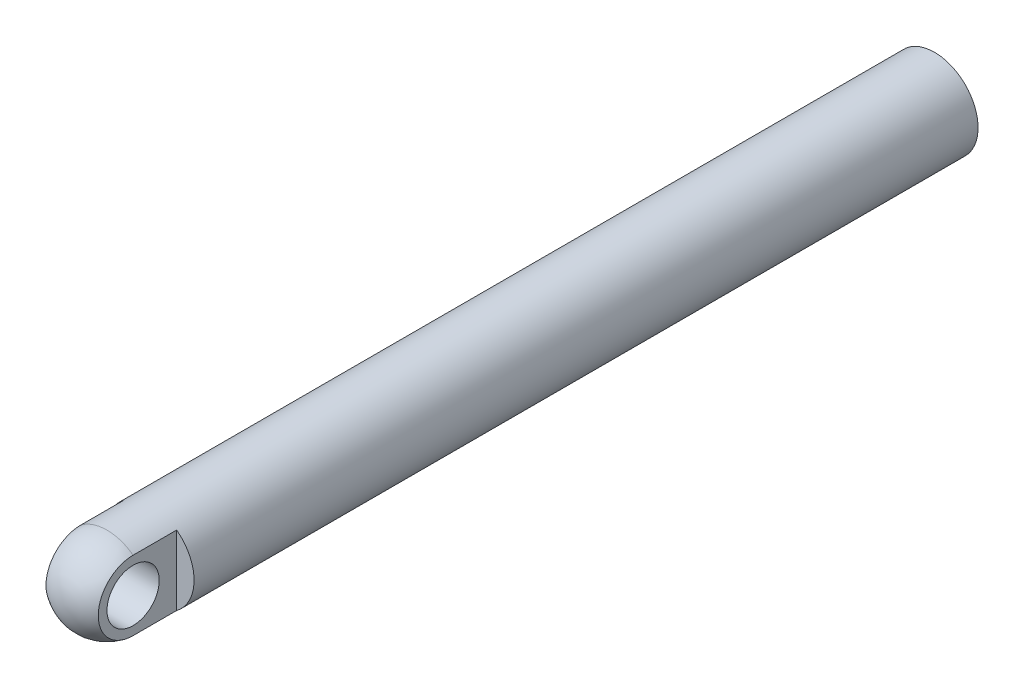
from build123d import *

# Parameters (mm, degrees)
SKETCH_1_R          = 50
EXTRUDE_1_DEPTH     = 1150
CUT_EXTRUDE_1_DEPTH = 100
SKETCH_3_R          = 30
CUT_EXTRUDE_2_DEPTH = 100
SKETCH_4_R          = 50
CUT_EXTRUDE_3_DEPTH = 100
SKETCH_6_R          = 72.906400888
CUT_EXTRUDE_4_DEPTH = 50
SCALE_1_SCALE       = 0.345


with BuildPart() as part:
    # 草图1 → 凸台-拉伸1 (new body)
    with BuildSketch(Plane.XY):
        Circle(SKETCH_1_R)
    extrude(amount=EXTRUDE_1_DEPTH)

    # 草图2 → 切除-拉伸1 (cut)
    with BuildSketch(Plane.XY.offset(1150)):
        Polygon((-30, 50), (-30, -50), (-82.719574124, -32.427051987), (-69.504020862, 45.153140313), align=None)
        Polygon((30, 50), (30, -50), (70.972415669, -45.887337717), (95.445662451, 11.135327286), align=None)
    extrude(amount=-CUT_EXTRUDE_1_DEPTH, mode=Mode.SUBTRACT)

    # 草图3 → 切除-拉伸2 (cut)
    with BuildSketch(Plane(origin=(30, 0, 0), x_dir=(0, 0, -1), z_dir=(1, 0, 0))):
        with Locations((-1100, 0)):
            Circle(SKETCH_3_R)
    extrude(amount=-CUT_EXTRUDE_2_DEPTH, mode=Mode.SUBTRACT)

    # 圆角1: read off the stored shape, not the designer's step
    # 圆角1 outline → 圆角1 (revolve, cut)
    with BuildSketch(Plane.XZ):
        with BuildLine():
            ThreePointArc((0, 1150), (35.355339077, 1135.355339042), (50, 1099.99999995))
            Line((50, 1099.99999995), (50, 1150))
            Line((50, 1150), (0, 1150))
        make_face()
    revolve(axis=Axis((0, 0, 0), (0, 0, 1)), mode=Mode.SUBTRACT)

    # 草图4 → 切除-拉伸3 (cut)
    with BuildSketch(Plane(origin=(0, 0, 0), x_dir=(-1, 0, 0), z_dir=(0, 0, -1))):
        Circle(SKETCH_4_R)
    extrude(amount=-CUT_EXTRUDE_3_DEPTH, mode=Mode.SUBTRACT)

    # 草图6 → 切除-拉伸4 (cut)
    with BuildSketch(Plane(origin=(0, 0, 100), x_dir=(-1, 0, 0), z_dir=(0, 0, -1))):
        Circle(SKETCH_6_R)
    extrude(amount=-CUT_EXTRUDE_4_DEPTH, mode=Mode.SUBTRACT)


with BuildPart() as part_1:
    # 缩放比例1: scaled about (0, 0, 0)
    add(part.part.scale(SCALE_1_SCALE))


solid = part_1.part
